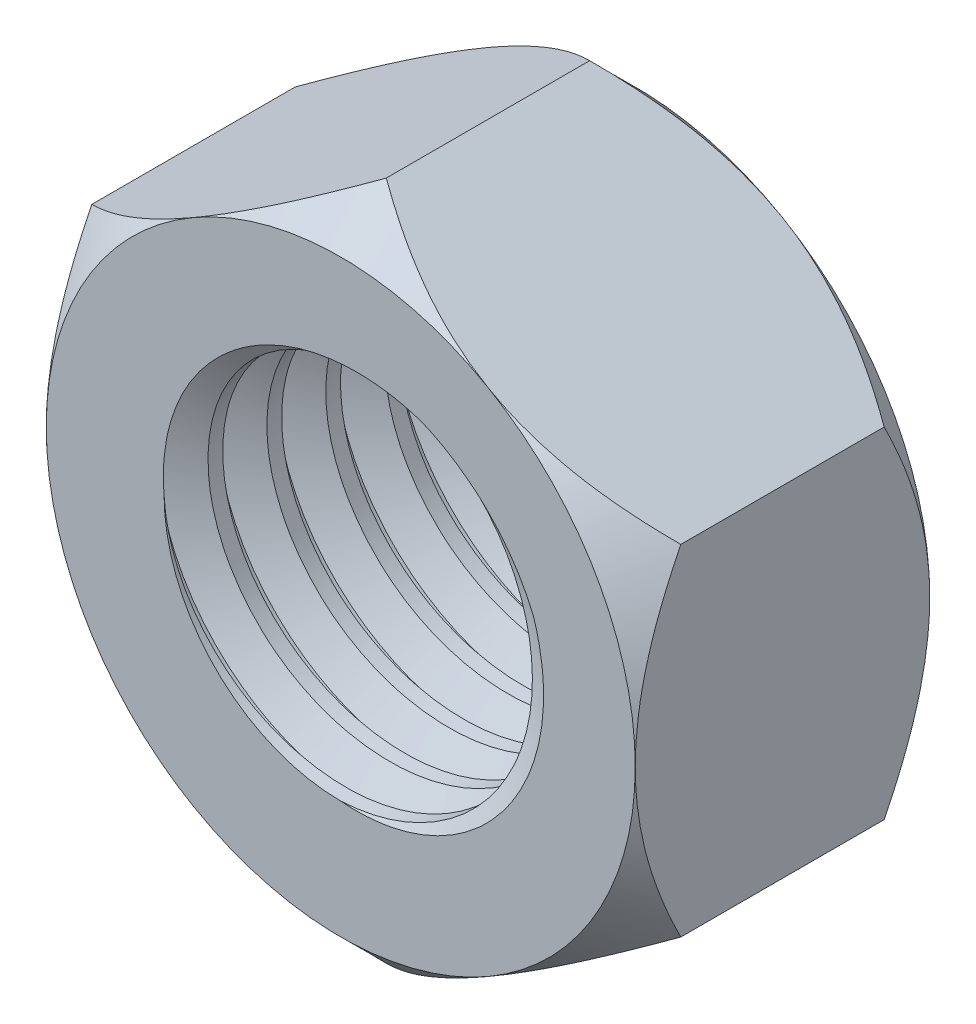
from build123d import *

# Parameters (mm, degrees)
SKETCH1_R               = 3
BOSS_EXTRUDE2_DEPTH     = 2.5
SKETCH2_R               = 3
CUT_EXTRUDE2_DEPTH      = 10.128709292
THREAD2_PITCH           = 1
SKETCH3_OUTSIDE_W       = 35.214
SKETCH3_OUTSIDE_H       = 36.762
SKETCH3_OUTSIDE_R       = 5
CUT_EXTRUDE3_DEPTH      = 10
CUT_EXTRUDE3_DRAFT      = -45
MIRROR1_COPY_1_SKETCH_W = 35.214
MIRROR1_COPY_1_SKETCH_H = 36.762
MIRROR1_COPY_1_SKETCH_R = 5
MIRROR1_COPY_1_DEPTH    = 10
MIRROR1_COPY_1_DRAFT    = -45


with BuildPart() as part:
    # Sketch1 → Boss-Extrude2 (new, symmetric)
    # profile 1 of 2: a face of its own
    with BuildSketch(Plane.XY):
        Polygon((-5, -2.886751346), (0, -5.773502692), (5, -2.886751346), (5, 2.886751346), (0, 5.773502692), (-5, 2.886751346), align=None)
        Circle(SKETCH1_R, mode=Mode.SUBTRACT)
    # profile 2 of 2: a face of its own
    with BuildSketch(Plane.XY):
        Circle(SKETCH1_R)
    extrude(amount=BOSS_EXTRUDE2_DEPTH, both=True)

    # Sketch2 → Cut-Extrude2 (cut, through all)
    with BuildSketch(Plane.XY.offset(2.5)):
        Circle(SKETCH2_R)
    extrude(amount=-CUT_EXTRUDE2_DEPTH, mode=Mode.SUBTRACT)

    # Thread2: the profile of Thread Profile2 profile screwed along a left-hand helix of 26 turns, 8 arcs to a turn; built about Z, then put on its axis
    thread2_z = Axis((0, 0, 0), (0, 0, 1))
    thread2_corners = [(2.9997, 0, -0.000173205), (3.541265875, 0, 0.312499999), (3.541265875, 0, 0.437499999), (2.9997, 0, 0.750173202)]
    with BuildLine(mode=Mode.PRIVATE) as thread2_profile:
        Line(thread2_corners[0], thread2_corners[1])
        Line(thread2_corners[1], thread2_corners[2])
        Line(thread2_corners[2], thread2_corners[3])
        Line(thread2_corners[3], thread2_corners[0])
    thread2_cap = Face(thread2_profile.wire())
    thread2_turn_angles = [0, -22.5, -45, -67.5, -90, -112.5, -135, -157.5, -180, -202.5, -225, -247.5, -270, -292.5, -315, -337.5, -360]
    thread2_turn_weights = [1, 0.9238795325112867, 1, 0.9238795325112867, 1, 0.9238795325112867, 1, 0.9238795325112867, 1, 0.9238795325112867, 1, 0.9238795325112867, 1, 0.9238795325112867, 1, 0.9238795325112867, 1]
    thread2_turn_rails = [Edge.make_bspline([Vector(p[0], p[1], 0).rotate(thread2_z, thread2_turn_angles[k]) / thread2_turn_weights[k] + Vector(0, 0, p[2] + -THREAD2_PITCH * thread2_turn_angles[k] / 360) for k in range(17)], [0, 0, 0, 1, 1, 2, 2, 3, 3, 4, 4, 5, 5, 6, 6, 7, 7, 8, 8, 8], 2, thread2_turn_weights) for p in thread2_corners]
    thread2_turn_sides = [Face.make_surface_from_curves(thread2_turn_rails[p[0]], thread2_turn_rails[p[1]]) for p in [(0, 1), (1, 2), (2, 3), (3, 0)]]
    thread2 = Plane(origin=(0, 0, 4.5), x_dir=(-1, 0, 0), z_dir=(0, 0, -1)) * Solid(Shell([*[p.moved(Location((0, 0, THREAD2_PITCH * i))) for i in range(26) for p in thread2_turn_sides], thread2_cap, thread2_cap.rotate(thread2_z, -9360).moved(Location((0, 0, -THREAD2_PITCH * -9360 / 360)))]))
    add(thread2, mode=Mode.SUBTRACT)


with BuildPart() as cut_extrude3_tool:
    # Sketch3 outside → Cut-Extrude3 (with draft: the straight prism first)
    with BuildSketch(Plane.XY.offset(2.5)):
        Rectangle(SKETCH3_OUTSIDE_W, SKETCH3_OUTSIDE_H)
        Circle(SKETCH3_OUTSIDE_R, mode=Mode.SUBTRACT)
    extrude(amount=-CUT_EXTRUDE3_DEPTH)
    # Cut-Extrude3: the draft: its side faces are tilted about the plane it starts from
    cut_extrude3_sides = [cut_extrude3_tool.faces().sort_by_distance(p)[0] for p in [
        (0, -18.381, -2.5),
        (17.607, 0, -2.5),
        (0, 18.381, -2.5),
        (-17.607, 0, -2.5),
        (-5, 0, -2.5),
    ]]
    draft(cut_extrude3_sides, Plane.XY.offset(2.5), CUT_EXTRUDE3_DRAFT)


with BuildPart() as part_1:
    add(part.part)

    # Cut-Extrude3: cut by cut_extrude3_tool
    add(cut_extrude3_tool.part, mode=Mode.SUBTRACT)


with BuildPart() as mirror1_copy_1_tool:
    # Mirror1 copy 1 sketch → Mirror1 copy 1 (with draft: the straight prism first)
    with BuildSketch(Plane(origin=(0, 0, -2.5), x_dir=(1, 0, 0), z_dir=(0, 0, -1))):
        Rectangle(MIRROR1_COPY_1_SKETCH_W, MIRROR1_COPY_1_SKETCH_H)
        Circle(MIRROR1_COPY_1_SKETCH_R, mode=Mode.SUBTRACT)
    extrude(amount=-MIRROR1_COPY_1_DEPTH)
    # Mirror1 copy 1: the draft: its side faces are tilted about the plane it starts from
    mirror1_copy_1_sides = [mirror1_copy_1_tool.faces().sort_by_distance(p)[0] for p in [
        (0, -18.381, 2.5),
        (17.607, 0, 2.5),
        (0, 18.381, 2.5),
        (-17.607, 0, 2.5),
        (-5, 0, 2.5),
    ]]
    draft(mirror1_copy_1_sides, Plane(origin=(0, 0, -2.5), x_dir=(1, 0, 0), z_dir=(0, 0, -1)), MIRROR1_COPY_1_DRAFT)


with BuildPart() as part_2:
    add(part_1.part)

    # Mirror1 copy 1: cut by mirror1_copy_1_tool
    add(mirror1_copy_1_tool.part, mode=Mode.SUBTRACT)


solid = part_2.part
